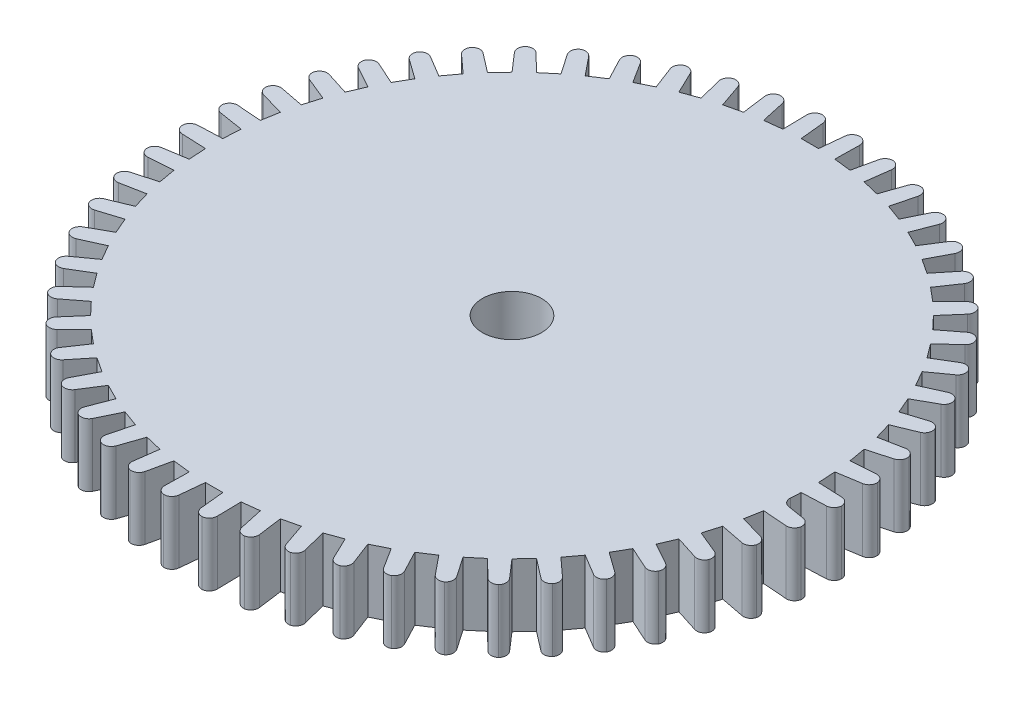
from build123d import *

# Parameters (mm, degrees)
SKETCH1_R           = 0.75
BOSS_EXTRUDE1_DEPTH = 1.6
FILLET2_R           = 0.2
FILLET3_R           = 0.2
FILLET4_R           = 0.2
FILLET5_R           = 0.2


with BuildPart() as part:
    # Sketch1 → Boss-Extrude1 (new body)
    with BuildSketch(Plane(origin=(0, 0, 0), x_dir=(1, 0, 0), z_dir=(0, 1, 0))):
        with BuildLine():
            Line((-0.22, 7.544609038), (0.22, 7.544609038))
            Line((0.22, 7.544609038), (0.3, 8.344609038))
            ThreePointArc((0.3, 8.344609038), (0.485509321, 8.335873122), (0.670778473, 8.323013651))
            Line((0.670778473, 8.323013651), (0.65736321, 7.519135532))
            Line((0.65736321, 7.519135532), (1.094388088, 7.46805465))
            Line((1.094388088, 7.46805465), (1.266721488, 8.253357903))
            ThreePointArc((1.266721488, 8.253357903), (1.449962284, 8.223144738), (1.632485818, 8.188863783))
            Line((1.632485818, 8.188863783), (1.525836711, 7.391978617))
            Line((1.525836711, 7.391978617), (1.953976454, 7.290507634))
            Line((1.953976454, 7.290507634), (2.216312741, 8.05049426))
            ThreePointArc((2.216312741, 8.05049426), (2.394806993, 7.999212428), (2.572116593, 7.94397358))
            Line((2.572116593, 7.94397358), (2.373675888, 7.164857871))
            Line((2.373675888, 7.164857871), (2.787140641, 7.014369008))
            Line((2.787140641, 7.014369008), (3.135932165, 7.738761494))
            ThreePointArc((3.135932165, 7.738761494), (3.307266046, 7.667104492), (3.476963903, 7.591654761))
            Line((3.476963903, 7.591654761), (3.18941517, 6.840844715))
            Line((3.18941517, 6.840844715), (3.582613532, 6.643373075))
            Line((3.582613532, 6.643373075), (4.013143488, 7.322375253))
            ThreePointArc((4.013143488, 7.322375253), (4.175, 7.231312122), (4.334791242, 7.136671836))
            Line((4.334791242, 7.136671836), (3.962023084, 6.424320868))
            Line((3.962023084, 6.424320868), (4.329637721, 6.182536918))
            Line((4.329637721, 6.182536918), (4.836083928, 6.806966449))
            ThreePointArc((4.836083928, 6.806966449), (4.986274241, 6.69772866), (5.133997964, 6.585177667))
            Line((5.133997964, 6.585177667), (4.681051432, 5.920919103))
            Line((4.681051432, 5.920919103), (5.018110987, 5.638092555))
            Line((5.018110987, 5.638092555), (5.59362463, 6.199505101))
            ThreePointArc((5.59362463, 6.199505101), (5.730117676, 6.073569907), (5.863776172, 5.944630266))
            Line((5.863776172, 5.944630266), (5.33677659, 5.337447065))
            Line((5.33677659, 5.337447065), (5.638722911, 5.017402662))
            Line((5.638722911, 5.017402662), (6.275521155, 5.508206081))
            ThreePointArc((6.275521155, 5.508206081), (6.3964711, 5.367276541), (6.514256866, 5.223691939))
            Line((6.514256866, 5.223691939), (5.920331, 4.681795211))
            Line((5.920331, 4.681795211), (6.18308078, 4.328861006))
            Line((6.18308078, 4.328861006), (6.872552022, 4.742418024))
            ThreePointArc((6.872552022, 4.742418024), (6.976323225, 4.588399967), (7.076643412, 4.43211214))
            Line((7.076643412, 4.43211214), (6.423823089, 3.962830108))
            Line((6.423823089, 3.962830108), (6.643823089, 3.58177893))
            Line((6.643823089, 3.58177893), (7.376643412, 3.912496898))
            ThreePointArc((7.376643412, 3.912496898), (7.461832547, 3.747473155), (7.543330495, 3.580595628))
            Line((7.543330495, 3.580595628), (6.84044399, 3.190274526))
            Line((6.84044399, 3.190274526), (7.014719087, 2.786259439))
            Line((7.014719087, 2.786259439), (7.780978354, 3.029665963))
            ThreePointArc((7.780978354, 3.029665963), (7.846433384, 2.855868197), (7.908006973, 2.680657702))
            Line((7.908006973, 2.680657702), (7.164559622, 2.374575954))
            Line((7.164559622, 2.374575954), (7.290753044, 1.953060569))
            Line((7.290753044, 1.953060569), (8.080088913, 2.105863994))
            ThreePointArc((8.080088913, 2.105863994), (8.124924669, 1.925642521), (8.165741223, 1.744468479))
            Line((8.165741223, 1.744468479), (7.391786875, 1.526765316))
            Line((7.391786875, 1.526765316), (7.468192073, 1.093449905))
            Line((7.468192073, 1.093449905), (8.26993013, 1.153583827))
            ThreePointArc((8.26993013, 1.153583827), (8.293540287, 0.969375833), (8.313047832, 0.784688312))
            Line((8.313047832, 0.784688312), (7.519052891, 0.658307797))
            Line((7.519052891, 0.658307797), (7.544636616, 0.219052207))
            Line((7.544636616, 0.219052207), (8.347934729, 0.185703417))
            ThreePointArc((8.347934729, 0.185703417), (8.35, 0), (8.347934729, -0.185703417))
            Line((8.347934729, -0.185703417), (7.544636616, -0.219052207))
            Line((7.544636616, -0.219052207), (7.519052891, -0.658307797))
            Line((7.519052891, -0.658307797), (8.313047832, -0.784688312))
            ThreePointArc((8.313047832, -0.784688312), (8.293540287, -0.969375833), (8.26993013, -1.153583827))
            Line((8.26993013, -1.153583827), (7.468192073, -1.093449905))
            Line((7.468192073, -1.093449905), (7.391786875, -1.526765316))
            Line((7.391786875, -1.526765316), (8.165741223, -1.744468479))
            ThreePointArc((8.165741223, -1.744468479), (8.124924669, -1.925642521), (8.080088913, -2.105863994))
            Line((8.080088913, -2.105863994), (7.290753044, -1.953060569))
            Line((7.290753044, -1.953060569), (7.164559622, -2.374575954))
            Line((7.164559622, -2.374575954), (7.908006973, -2.680657702))
            ThreePointArc((7.908006973, -2.680657702), (7.846433384, -2.855868197), (7.780978354, -3.029665963))
            Line((7.780978354, -3.029665963), (7.014719087, -2.786259439))
            Line((7.014719087, -2.786259439), (6.84044399, -3.190274526))
            Line((6.84044399, -3.190274526), (7.543330495, -3.580595628))
            ThreePointArc((7.543330495, -3.580595628), (7.461832547, -3.747473155), (7.376643412, -3.912496898))
            Line((7.376643412, -3.912496898), (6.643823089, -3.58177893))
            Line((6.643823089, -3.58177893), (6.423823089, -3.962830108))
            Line((6.423823089, -3.962830108), (7.076643412, -4.43211214))
            ThreePointArc((7.076643412, -4.43211214), (6.976323225, -4.588399967), (6.872552022, -4.742418024))
            Line((6.872552022, -4.742418024), (6.18308078, -4.328861006))
            Line((6.18308078, -4.328861006), (5.920331, -4.681795211))
            Line((5.920331, -4.681795211), (6.514256866, -5.223691939))
            ThreePointArc((6.514256866, -5.223691939), (6.3964711, -5.367276541), (6.275521155, -5.508206081))
            Line((6.275521155, -5.508206081), (5.638722911, -5.017402662))
            Line((5.638722911, -5.017402662), (5.33677659, -5.337447065))
            Line((5.33677659, -5.337447065), (5.863776172, -5.944630266))
            ThreePointArc((5.863776172, -5.944630266), (5.730117676, -6.073569907), (5.59362463, -6.199505101))
            Line((5.59362463, -6.199505101), (5.018110987, -5.638092555))
            Line((5.018110987, -5.638092555), (4.681051432, -5.920919103))
            Line((4.681051432, -5.920919103), (5.133997964, -6.585177667))
            ThreePointArc((5.133997964, -6.585177667), (4.986274241, -6.69772866), (4.836083928, -6.806966449))
            Line((4.836083928, -6.806966449), (4.329637721, -6.182536918))
            Line((4.329637721, -6.182536918), (3.962023084, -6.424320868))
            Line((3.962023084, -6.424320868), (4.334791242, -7.136671836))
            ThreePointArc((4.334791242, -7.136671836), (4.175, -7.231312122), (4.013143488, -7.322375253))
            Line((4.013143488, -7.322375253), (3.582613532, -6.643373075))
            Line((3.582613532, -6.643373075), (3.18941517, -6.840844715))
            Line((3.18941517, -6.840844715), (3.476963903, -7.591654761))
            ThreePointArc((3.476963903, -7.591654761), (3.307266046, -7.667104492), (3.135932165, -7.738761494))
            Line((3.135932165, -7.738761494), (2.787140641, -7.014369008))
            Line((2.787140641, -7.014369008), (2.373675888, -7.164857871))
            Line((2.373675888, -7.164857871), (2.572116593, -7.94397358))
            ThreePointArc((2.572116593, -7.94397358), (2.394806993, -7.999212428), (2.216312741, -8.05049426))
            Line((2.216312741, -8.05049426), (1.953976454, -7.290507634))
            Line((1.953976454, -7.290507634), (1.525836711, -7.391978617))
            Line((1.525836711, -7.391978617), (1.632485818, -8.188863783))
            ThreePointArc((1.632485818, -8.188863783), (1.449962284, -8.223144738), (1.266721488, -8.253357903))
            Line((1.266721488, -8.253357903), (1.094388088, -7.46805465))
            Line((1.094388088, -7.46805465), (0.65736321, -7.519135532))
            Line((0.65736321, -7.519135532), (0.670778473, -8.323013651))
            ThreePointArc((0.670778473, -8.323013651), (0.485509321, -8.335873122), (0.3, -8.344609038))
            Line((0.3, -8.344609038), (0.22, -7.544609038))
            Line((0.22, -7.544609038), (-0.22, -7.544609038))
            Line((-0.22, -7.544609038), (-0.3, -8.344609038))
            ThreePointArc((-0.3, -8.344609038), (-0.485509321, -8.335873122), (-0.670778473, -8.323013651))
            Line((-0.670778473, -8.323013651), (-0.65736321, -7.519135532))
            Line((-0.65736321, -7.519135532), (-1.094388088, -7.46805465))
            Line((-1.094388088, -7.46805465), (-1.266721488, -8.253357903))
            ThreePointArc((-1.266721488, -8.253357903), (-1.449962284, -8.223144738), (-1.632485818, -8.188863783))
            Line((-1.632485818, -8.188863783), (-1.525836711, -7.391978617))
            Line((-1.525836711, -7.391978617), (-1.953976454, -7.290507634))
            Line((-1.953976454, -7.290507634), (-2.216312741, -8.05049426))
            ThreePointArc((-2.216312741, -8.05049426), (-2.394806993, -7.999212428), (-2.572116593, -7.94397358))
            Line((-2.572116593, -7.94397358), (-2.373675888, -7.164857871))
            Line((-2.373675888, -7.164857871), (-2.787140641, -7.014369008))
            Line((-2.787140641, -7.014369008), (-3.135932165, -7.738761494))
            ThreePointArc((-3.135932165, -7.738761494), (-3.307266046, -7.667104492), (-3.476963903, -7.591654761))
            Line((-3.476963903, -7.591654761), (-3.18941517, -6.840844715))
            Line((-3.18941517, -6.840844715), (-3.582613532, -6.643373075))
            Line((-3.582613532, -6.643373075), (-4.013143488, -7.322375253))
            ThreePointArc((-4.013143488, -7.322375253), (-4.175, -7.231312122), (-4.334791242, -7.136671836))
            Line((-4.334791242, -7.136671836), (-3.962023084, -6.424320868))
            Line((-3.962023084, -6.424320868), (-4.329637721, -6.182536918))
            Line((-4.329637721, -6.182536918), (-4.836083928, -6.806966449))
            ThreePointArc((-4.836083928, -6.806966449), (-4.986274241, -6.69772866), (-5.133997964, -6.585177667))
            Line((-5.133997964, -6.585177667), (-4.681051432, -5.920919103))
            Line((-4.681051432, -5.920919103), (-5.018110987, -5.638092555))
            Line((-5.018110987, -5.638092555), (-5.59362463, -6.199505101))
            ThreePointArc((-5.59362463, -6.199505101), (-5.730117676, -6.073569907), (-5.863776172, -5.944630266))
            Line((-5.863776172, -5.944630266), (-5.33677659, -5.337447065))
            Line((-5.33677659, -5.337447065), (-5.638722911, -5.017402662))
            Line((-5.638722911, -5.017402662), (-6.275521155, -5.508206081))
            ThreePointArc((-6.275521155, -5.508206081), (-6.3964711, -5.367276541), (-6.514256866, -5.223691939))
            Line((-6.514256866, -5.223691939), (-5.920331, -4.681795211))
            Line((-5.920331, -4.681795211), (-6.18308078, -4.328861006))
            Line((-6.18308078, -4.328861006), (-6.872552022, -4.742418024))
            ThreePointArc((-6.872552022, -4.742418024), (-6.976323225, -4.588399967), (-7.076643412, -4.43211214))
            Line((-7.076643412, -4.43211214), (-6.423823089, -3.962830108))
            Line((-6.423823089, -3.962830108), (-6.643823089, -3.58177893))
            Line((-6.643823089, -3.58177893), (-7.376643412, -3.912496898))
            ThreePointArc((-7.376643412, -3.912496898), (-7.461832547, -3.747473155), (-7.543330495, -3.580595628))
            Line((-7.543330495, -3.580595628), (-6.84044399, -3.190274526))
            Line((-6.84044399, -3.190274526), (-7.014719087, -2.786259439))
            Line((-7.014719087, -2.786259439), (-7.780978354, -3.029665963))
            ThreePointArc((-7.780978354, -3.029665963), (-7.846433384, -2.855868197), (-7.908006973, -2.680657702))
            Line((-7.908006973, -2.680657702), (-7.164559622, -2.374575954))
            Line((-7.164559622, -2.374575954), (-7.290753044, -1.953060569))
            Line((-7.290753044, -1.953060569), (-8.080088913, -2.105863994))
            ThreePointArc((-8.080088913, -2.105863994), (-8.124924669, -1.925642521), (-8.165741223, -1.744468479))
            Line((-8.165741223, -1.744468479), (-7.391786875, -1.526765316))
            Line((-7.391786875, -1.526765316), (-7.468192073, -1.093449905))
            Line((-7.468192073, -1.093449905), (-8.26993013, -1.153583827))
            ThreePointArc((-8.26993013, -1.153583827), (-8.293540287, -0.969375833), (-8.313047832, -0.784688312))
            Line((-8.313047832, -0.784688312), (-7.519052891, -0.658307797))
            Line((-7.519052891, -0.658307797), (-7.544636616, -0.219052207))
            Line((-7.544636616, -0.219052207), (-8.347934729, -0.185703417))
            ThreePointArc((-8.347934729, -0.185703417), (-8.35, 0), (-8.347934729, 0.185703417))
            Line((-8.347934729, 0.185703417), (-7.544636616, 0.219052207))
            Line((-7.544636616, 0.219052207), (-7.519052891, 0.658307797))
            Line((-7.519052891, 0.658307797), (-8.313047832, 0.784688312))
            ThreePointArc((-8.313047832, 0.784688312), (-8.293540287, 0.969375833), (-8.26993013, 1.153583827))
            Line((-8.26993013, 1.153583827), (-7.468192073, 1.093449905))
            Line((-7.468192073, 1.093449905), (-7.391786875, 1.526765316))
            Line((-7.391786875, 1.526765316), (-8.165741223, 1.744468479))
            ThreePointArc((-8.165741223, 1.744468479), (-8.124924669, 1.925642521), (-8.080088913, 2.105863994))
            Line((-8.080088913, 2.105863994), (-7.290753044, 1.953060569))
            Line((-7.290753044, 1.953060569), (-7.164559622, 2.374575954))
            Line((-7.164559622, 2.374575954), (-7.908006973, 2.680657702))
            ThreePointArc((-7.908006973, 2.680657702), (-7.846433384, 2.855868197), (-7.780978354, 3.029665963))
            Line((-7.780978354, 3.029665963), (-7.014719087, 2.786259439))
            Line((-7.014719087, 2.786259439), (-6.84044399, 3.190274526))
            Line((-6.84044399, 3.190274526), (-7.543330495, 3.580595628))
            ThreePointArc((-7.543330495, 3.580595628), (-7.461832547, 3.747473155), (-7.376643412, 3.912496898))
            Line((-7.376643412, 3.912496898), (-6.643823089, 3.58177893))
            Line((-6.643823089, 3.58177893), (-6.423823089, 3.962830108))
            Line((-6.423823089, 3.962830108), (-7.076643412, 4.43211214))
            ThreePointArc((-7.076643412, 4.43211214), (-6.976323225, 4.588399967), (-6.872552022, 4.742418024))
            Line((-6.872552022, 4.742418024), (-6.18308078, 4.328861006))
            Line((-6.18308078, 4.328861006), (-5.920331, 4.681795211))
            Line((-5.920331, 4.681795211), (-6.514256866, 5.223691939))
            ThreePointArc((-6.514256866, 5.223691939), (-6.3964711, 5.367276541), (-6.275521155, 5.508206081))
            Line((-6.275521155, 5.508206081), (-5.638722911, 5.017402662))
            Line((-5.638722911, 5.017402662), (-5.33677659, 5.337447065))
            Line((-5.33677659, 5.337447065), (-5.863776172, 5.944630266))
            ThreePointArc((-5.863776172, 5.944630266), (-5.730117676, 6.073569907), (-5.59362463, 6.199505101))
            Line((-5.59362463, 6.199505101), (-5.018110987, 5.638092555))
            Line((-5.018110987, 5.638092555), (-4.681051432, 5.920919103))
            Line((-4.681051432, 5.920919103), (-5.133997964, 6.585177667))
            ThreePointArc((-5.133997964, 6.585177667), (-4.986274241, 6.69772866), (-4.836083928, 6.806966449))
            Line((-4.836083928, 6.806966449), (-4.329637721, 6.182536918))
            Line((-4.329637721, 6.182536918), (-3.962023084, 6.424320868))
            Line((-3.962023084, 6.424320868), (-4.334791242, 7.136671836))
            ThreePointArc((-4.334791242, 7.136671836), (-4.175, 7.231312122), (-4.013143488, 7.322375253))
            Line((-4.013143488, 7.322375253), (-3.582613532, 6.643373075))
            Line((-3.582613532, 6.643373075), (-3.18941517, 6.840844715))
            Line((-3.18941517, 6.840844715), (-3.476963903, 7.591654761))
            ThreePointArc((-3.476963903, 7.591654761), (-3.307266046, 7.667104492), (-3.135932165, 7.738761494))
            Line((-3.135932165, 7.738761494), (-2.787140641, 7.014369008))
            Line((-2.787140641, 7.014369008), (-2.373675888, 7.164857871))
            Line((-2.373675888, 7.164857871), (-2.572116593, 7.94397358))
            ThreePointArc((-2.572116593, 7.94397358), (-2.394806993, 7.999212428), (-2.216312741, 8.05049426))
            Line((-2.216312741, 8.05049426), (-1.953976454, 7.290507634))
            Line((-1.953976454, 7.290507634), (-1.525836711, 7.391978617))
            Line((-1.525836711, 7.391978617), (-1.632485818, 8.188863783))
            ThreePointArc((-1.632485818, 8.188863783), (-1.449962284, 8.223144738), (-1.266721488, 8.253357903))
            Line((-1.266721488, 8.253357903), (-1.094388088, 7.46805465))
            Line((-1.094388088, 7.46805465), (-0.65736321, 7.519135532))
            Line((-0.65736321, 7.519135532), (-0.670778473, 8.323013651))
            ThreePointArc((-0.670778473, 8.323013651), (-0.485509321, 8.335873122), (-0.3, 8.344609038))
            Line((-0.3, 8.344609038), (-0.22, 7.544609038))
        make_face()
        with Locations(Location((0, 0, 0), (0, 0, 270))):
            Circle(SKETCH1_R, mode=Mode.SUBTRACT)
    extrude(amount=BOSS_EXTRUDE1_DEPTH)

    # Fillet2
    # the kernel refuses this fillet: 0.2 mm, written as the material it takes off along each edge
    with BuildSketch(Plane(origin=(4.334791242, -0.480298583, 7.136671836), x_dir=(-0.46364772510243835, 0, -0.8860196312764937), z_dir=(0, 1, 0))) as fillet2_piece_1:
        with BuildLine():
            CenterArc((0.189804657, 0.2), FILLET2_R, 182.333310568, 87.666689432)
            ThreePointArc((-0.010029522, 0.191857461), (-0.005566569, 0.095899884), (0, 0))
            Line((0, 0), (0.189804657, 0))
        make_face()
    extrude(amount=2.560597165, mode=Mode.SUBTRACT)
    with BuildSketch(Plane(origin=(4.013143488, -0.480298583, 7.322375253), x_dir=(0.8713440550306768, 0, -0.49067253618140977), z_dir=(0, 1, 0))) as fillet2_piece_2:
        with BuildLine():
            CenterArc((0.189818601, 0.199986765), FILLET2_R, 182.992464789, 87.666689432)
            Line((-0.00990868, 0.189545841), (0, 0))
            ThreePointArc((0, 0), (0.096059717, -0.000552561), (0.192119433, 0))
        make_face()
    extrude(amount=2.560597165, mode=Mode.SUBTRACT)

    # Fillet3
    # the kernel refuses this fillet: 0.2 mm, written as the material it adds along each edge
    with BuildSketch(Plane(origin=(7.519052891, 0, 0.658307797), x_dir=(0.98756811805152, 0, 0.15719164166131472), z_dir=(0, 1, 0))) as fillet3_piece_1:
        with BuildLine():
            CenterArc((FILLET3_R * 0.904987562112, FILLET3_R), FILLET3_R, 185.710593137, 84.289406863)
            Line((-FILLET3_R * 0.0900496280979, FILLET3_R * 0.900496280979), (0, 0))
            Line((0, 0), (FILLET3_R * 0.904987562112, 0))
        make_face()
    extrude(amount=1.6)
    # the kernel refuses this fillet: 0.2 mm, written as the material it takes off along each edge
    with BuildSketch(Plane(origin=(5.863776172, -0.480298583, -5.944630266), x_dir=(-0.6554802294286503, 0, 0.7552123336043739), z_dir=(0, 1, 0)), Plane(origin=(6.514256866, -0.480298583, -5.223691939), x_dir=(-0.7387229072014744, 0, 0.6740092479898195), z_dir=(0, 1, 0)), Plane(origin=(7.076643412, -0.480298583, -4.43211214), x_dir=(-0.81197562492164, 0, 0.5836913435482081), z_dir=(0, 1, 0)), Plane(origin=(7.543330495, -0.480298583, -3.580595628), x_dir=(-0.8742477652458406, 0, 0.4854800149982011), z_dir=(0, 1, 0)), Plane(origin=(7.908006973, -0.480298583, -2.680657702), x_dir=(-0.9246972043030404, 0, 0.38070340207849634), z_dir=(0, 1, 0)), Plane(origin=(8.165741223, -0.480298583, -1.744468479), x_dir=(-0.9626416999752018, 0, 0.27077842873621544), z_dir=(0, 1, 0)), Plane(origin=(8.313047832, -0.480298583, -0.784688312), x_dir=(-0.9875681180515197, 0, 0.15719164166131647), z_dir=(0, 1, 0)), Plane(origin=(8.347934729, -0.480298583, 0.185703417), x_dir=(-0.9991393714883839, 0, 0.041479107292674414), z_dir=(0, 1, 0)), Plane(origin=(8.26993013, -0.480298583, 1.153583827), x_dir=(-0.9971989789333593, 0, -0.07479436084536017), z_dir=(0, 1, 0)), Plane(origin=(8.080088913, -0.480298583, 2.105863994), x_dir=(-0.98177318086704, 0, -0.1900563635614821), z_dir=(0, 1, 0)), Plane(origin=(7.780978354, -0.480298583, 3.029665963), x_dir=(-0.9530705847455657, 0, -0.3027481799990632), z_dir=(0, 1, 0)), Plane(origin=(7.376643412, -0.480298583, 3.912496898), x_dir=(-0.9114793439426387, 0, -0.4113458466617805), z_dir=(0, 1, 0)), Plane(origin=(6.872552022, -0.480298583, 4.742418024), x_dir=(-0.8575619086410138, 0, -0.5143807664055701), z_dir=(0, 1, 0)), Plane(origin=(6.275521155, -0.480298583, 5.508206081), x_dir=(-0.7920474196586587, 0, -0.6104595686956351), z_dir=(0, 1, 0)), Plane(origin=(5.59362463, -0.480298583, 6.199505101), x_dir=(-0.7158218480699943, 0, -0.6982829525526582), z_dir=(0, 1, 0)), Plane(origin=(4.836083928, -0.480298583, 6.806966449), x_dir=(-0.6299160139670423, 0, -0.7766632573695456), z_dir=(0, 1, 0))) as fillet3_2_piece_1:
        with BuildLine():
            CenterArc((0.189804657, -0.2), FILLET3_R, 90, 87.666689432)
            ThreePointArc((-0.010029522, -0.191857461), (-0.005566569, -0.095899884), (0, 0))
            Line((0, 0), (0.189804657, 0))
        make_face()
    extrude(amount=2.560597165, mode=Mode.SUBTRACT)
    with BuildSketch(Plane(origin=(5.59362463, -0.480298583, -6.199505101), x_dir=(0.7346999890769462, 0, 0.6783921624328624), z_dir=(0, 1, 0)), Plane(origin=(6.275521155, -0.480298583, -5.508206081), x_dir=(0.6509756875272619, 0, 0.7590985800595393), z_dir=(0, 1, 0)), Plane(origin=(6.872552022, -0.480298583, -4.742418024), x_dir=(0.558448056542093, 0, 0.8295394916122796), z_dir=(0, 1, 0)), Plane(origin=(7.376643412, -0.480298583, -3.912496898), x_dir=(0.4583683736008077, 0, 0.8887623046026145), z_dir=(0, 1, 0)), Plane(origin=(7.780978354, -0.480298583, -3.029665963), x_dir=(0.3520900447301269, 0, 0.9359661320806096), z_dir=(0, 1, 0)), Plane(origin=(8.080088913, -0.480298583, -2.105863994), x_dir=(0.2410503020092946, 0, 0.9705126232570227), z_dir=(0, 1, 0)), Plane(origin=(8.26993013, -0.480298583, -1.153583827), x_dir=(0.1267507674716833, 0, 0.991934596102656), z_dir=(0, 1, 0)), Plane(origin=(8.347934729, -0.480298583, -0.185703417), x_dir=(0.010737146242911869, 0, 0.9999423551838168), z_dir=(0, 1, 0)), Plane(origin=(8.313047832, -0.480298583, 0.784688312), x_dir=(-0.10542167646940234, 0, 0.994427609296112), z_dir=(0, 1, 0)), Plane(origin=(8.165741223, -0.480298583, 1.744468479), x_dir=(-0.22015485185665176, 0, 0.9754649359172146), z_dir=(0, 1, 0)), Plane(origin=(7.908006973, -0.480298583, 2.680657702), x_dir=(-0.3319108105446167, 0, 0.9433107726744222), z_dir=(0, 1, 0)), Plane(origin=(7.543330495, -0.480298583, 3.580595628), x_dir=(-0.43917824490763746, 0, 0.8983999494656303), z_dir=(0, 1, 0)), Plane(origin=(7.076643412, -0.480298583, 4.43211214), x_dir=(-0.5405065469114751, 0, 0.8413398081309557), z_dir=(0, 1, 0)), Plane(origin=(6.514256866, -0.480298583, 5.223691939), x_dir=(-0.6345254250985933, 0, 0.7729019891962042), z_dir=(0, 1, 0)), Plane(origin=(5.863776172, -0.480298583, 5.944630266), x_dir=(-0.7199634354294149, 0, 0.6940119967584673), z_dir=(0, 1, 0)), Plane(origin=(5.133997964, -0.480298583, 6.585177667), x_dir=(-0.7956651753817232, 0, 0.6057366826309694), z_dir=(0, 1, 0))) as fillet3_2_piece_2:
        with BuildLine():
            CenterArc((0.189818601, -0.199986765), FILLET3_R, 89.340845779, 87.666689432)
            Line((-0.00990868, -0.189545841), (0, 0))
            ThreePointArc((0, 0), (0.096059717, 0.000552561), (0.192119433, 0))
        make_face()
    extrude(amount=2.560597165, mode=Mode.SUBTRACT)

    # Fillet4
    # the kernel refuses this fillet: 0.2 mm, written as the material it takes off along each edge
    with BuildSketch(Plane(origin=(-4.334791242, -0.480298583, 7.136671836), x_dir=(0.4636477251024346, 0, -0.8860196312764955), z_dir=(0, 1, 0)), Plane(origin=(-3.476963903, -0.480298583, 7.591654761), x_dir=(0.3576521040844768, 0, -0.9338548990308647), z_dir=(0, 1, 0)), Plane(origin=(-5.133997964, -0.480298583, 6.585177667), x_dir=(0.5633733060185829, 0, -0.8262024679615113), z_dir=(0, 1, 0)), Plane(origin=(-5.863776172, -0.480298583, 5.944630266), x_dir=(0.6554802294286552, 0, -0.7552123336043696), z_dir=(0, 1, 0)), Plane(origin=(-6.514256866, -0.480298583, 5.223691939), x_dir=(0.7387229072014774, 0, -0.6740092479898161), z_dir=(0, 1, 0)), Plane(origin=(-7.076643412, -0.480298583, 4.43211214), x_dir=(0.8119756249216388, 0, -0.5836913435482098), z_dir=(0, 1, 0)), Plane(origin=(-7.543330495, -0.480298583, 3.580595628), x_dir=(0.8742477652458391, 0, -0.4854800149982039), z_dir=(0, 1, 0)), Plane(origin=(-7.908006973, -0.480298583, 2.680657702), x_dir=(0.9246972043030436, 0, -0.3807034020784887), z_dir=(0, 1, 0)), Plane(origin=(-8.165741223, -0.480298583, 1.744468479), x_dir=(0.9626416999752027, 0, -0.27077842873621233), z_dir=(0, 1, 0)), Plane(origin=(-8.313047832, -0.480298583, 0.784688312), x_dir=(0.98756811805152, 0, -0.15719164166131375), z_dir=(0, 1, 0)), Plane(origin=(-8.347934729, -0.480298583, -0.185703417), x_dir=(0.9991393714883839, 0, -0.04147910729267451), z_dir=(0, 1, 0)), Plane(origin=(-8.26993013, -0.480298583, -1.153583827), x_dir=(0.9971989789333593, 0, 0.07479436084535854), z_dir=(0, 1, 0)), Plane(origin=(-8.080088913, -0.480298583, -2.105863994), x_dir=(0.98177318086704, 0, 0.1900563635614817), z_dir=(0, 1, 0)), Plane(origin=(-7.780978354, -0.480298583, -3.029665963), x_dir=(0.9530705847455657, 0, 0.3027481799990632), z_dir=(0, 1, 0)), Plane(origin=(-7.376643412, -0.480298583, -3.912496898), x_dir=(0.9114793439426382, 0, 0.41134584666178187), z_dir=(0, 1, 0)), Plane(origin=(-6.872552022, -0.480298583, -4.742418024), x_dir=(0.8575619086410154, 0, 0.5143807664055673), z_dir=(0, 1, 0)), Plane(origin=(-5.59362463, -0.480298583, -6.199505101), x_dir=(0.715821848069999, 0, 0.6982829525526533), z_dir=(0, 1, 0)), Plane(origin=(-6.275521155, -0.480298583, -5.508206081), x_dir=(0.7920474196586564, 0, 0.6104595686956378), z_dir=(0, 1, 0)), Plane(origin=(-4.836083928, -0.480298583, -6.806966449), x_dir=(0.6299160139670348, 0, 0.7766632573695517), z_dir=(0, 1, 0)), Plane(origin=(-4.013143488, -0.480298583, -7.322375253), x_dir=(0.5354916463859504, 0, 0.8445405239838195), z_dir=(0, 1, 0)), Plane(origin=(-3.135932165, -0.480298583, -7.738761494), x_dir=(0.4338256729147788, 0, 0.9009968288068717), z_dir=(0, 1, 0)), Plane(origin=(-1.266721488, -0.480298583, -8.253357903), x_dir=(0.21434767754407721, 0, 0.9767574279888843), z_dir=(0, 1, 0)), Plane(origin=(-2.216312741, -0.480298583, -8.05049426), x_dir=(0.32629295143839016, 0, 0.9452686971658505), z_dir=(0, 1, 0)), Plane(origin=(-0.3, -0.480298583, -8.344609038), x_dir=(0.09950371902100257, 0, 0.9950371902099888), z_dir=(0, 1, 0)), Plane(origin=(0.670778473, -0.480298583, -8.323013651), x_dir=(-0.016685856604826292, 0, 0.9998607814037728), z_dir=(0, 1, 0)), Plane(origin=(1.632485818, -0.480298583, -8.188863783), x_dir=(-0.13264978464438845, 0, 0.9911629707741293), z_dir=(0, 1, 0)), Plane(origin=(2.572116593, -0.480298583, -7.94397358), x_dir=(-0.24681985190520428, 0, 0.9690613812888701), z_dir=(0, 1, 0)), Plane(origin=(3.476963903, -0.480298583, -7.591654761), x_dir=(-0.35765210408447834, 0, 0.9338548990308642), z_dir=(0, 1, 0)), Plane(origin=(4.334791242, -0.480298583, -7.136671836), x_dir=(-0.4636477251024367, 0, 0.8860196312764944), z_dir=(0, 1, 0)), Plane(origin=(5.133997964, -0.480298583, -6.585177667), x_dir=(-0.5633733060185832, 0, 0.8262024679615113), z_dir=(0, 1, 0))) as fillet4_piece_1:
        with BuildLine():
            CenterArc((0.189804657, -0.2), FILLET4_R, 90, 87.666689432)
            ThreePointArc((-0.010029522, -0.191857461), (-0.005566569, -0.095899884), (0, 0))
            Line((0, 0), (0.189804657, 0))
        make_face()
    extrude(amount=2.560597165, mode=Mode.SUBTRACT)
    with BuildSketch(Plane(origin=(-4.013143488, -0.480298583, 7.322375253), x_dir=(-0.8713440550306827, 0, -0.4906725361813992), z_dir=(0, 1, 0)), Plane(origin=(-3.135932165, -0.480298583, 7.738761494), x_dir=(-0.9224159428533883, 0, -0.3861979134717), z_dir=(0, 1, 0)), Plane(origin=(-4.836083928, -0.480298583, 6.806966449), x_dir=(-0.8084887336403573, 0, -0.5885116545801038), z_dir=(0, 1, 0)), Plane(origin=(-5.59362463, -0.480298583, 6.199505101), x_dir=(-0.734699989076951, 0, -0.6783921624328572), z_dir=(0, 1, 0)), Plane(origin=(-6.275521155, -0.480298583, 5.508206081), x_dir=(-0.6509756875272619, 0, -0.7590985800595393), z_dir=(0, 1, 0)), Plane(origin=(-6.872552022, -0.480298583, 4.742418024), x_dir=(-0.5584480565420684, 0, -0.8295394916122961), z_dir=(0, 1, 0)), Plane(origin=(-7.376643412, -0.480298583, 3.912496898), x_dir=(-0.45836837360079474, 0, -0.8887623046026212), z_dir=(0, 1, 0)), Plane(origin=(-7.780978354, -0.480298583, 3.029665963), x_dir=(-0.3520900447301365, 0, -0.935966132080606), z_dir=(0, 1, 0)), Plane(origin=(-8.080088913, -0.480298583, 2.105863994), x_dir=(-0.24105030200928482, 0, -0.9705126232570253), z_dir=(0, 1, 0)), Plane(origin=(-8.26993013, -0.480298583, 1.153583827), x_dir=(-0.12675076747165503, 0, -0.9919345961026595), z_dir=(0, 1, 0)), Plane(origin=(-8.347934729, -0.480298583, 0.185703417), x_dir=(-0.010737146242902671, 0, -0.9999423551838169), z_dir=(0, 1, 0)), Plane(origin=(-8.313047832, -0.480298583, -0.784688312), x_dir=(0.1054216764694024, 0, -0.994427609296112), z_dir=(0, 1, 0)), Plane(origin=(-8.165741223, -0.480298583, -1.744468479), x_dir=(0.22015485185663566, 0, -0.9754649359172183), z_dir=(0, 1, 0)), Plane(origin=(-7.908006973, -0.480298583, -2.680657702), x_dir=(0.3319108105446235, 0, -0.9433107726744199), z_dir=(0, 1, 0)), Plane(origin=(-7.543330495, -0.480298583, -3.580595628), x_dir=(0.43917824490763846, 0, -0.8983999494656298), z_dir=(0, 1, 0)), Plane(origin=(-7.076643412, -0.480298583, -4.43211214), x_dir=(0.5405065469114728, 0, -0.8413398081309572), z_dir=(0, 1, 0)), Plane(origin=(-5.863776172, -0.480298583, -5.944630266), x_dir=(0.7199634354294149, 0, -0.6940119967584673), z_dir=(0, 1, 0)), Plane(origin=(-6.514256866, -0.480298583, -5.223691939), x_dir=(0.6345254250986062, 0, -0.7729019891961938), z_dir=(0, 1, 0)), Plane(origin=(-5.133997964, -0.480298583, -6.585177667), x_dir=(0.795665175381731, 0, -0.6057366826309591), z_dir=(0, 1, 0)), Plane(origin=(-4.334791242, -0.480298583, -7.136671836), x_dir=(0.8606069087877749, 0, -0.509269819002413), z_dir=(0, 1, 0)), Plane(origin=(-3.476963903, -0.480298583, -7.591654761), x_dir=(0.9139104101097595, 0, -0.4059159547160115), z_dir=(0, 1, 0)), Plane(origin=(-1.632485818, -0.480298583, -8.188863783), x_dir=(0.9828864980717174, 0, -0.1842121926157874), z_dir=(0, 1, 0)), Plane(origin=(-2.572116593, -0.480298583, -7.94397358), x_dir=(0.9548548409338602, 0, -0.2970727734834894), z_dir=(0, 1, 0)), Plane(origin=(-0.670778473, -0.480298583, -8.323013651), x_dir=(0.9976263014497105, 0, -0.06886045785333675), z_dir=(0, 1, 0)), Plane(origin=(0.3, -0.480298583, -8.344609038), x_dir=(0.9988749205122716, 0, 0.04742249647164526), z_dir=(0, 1, 0)), Plane(origin=(1.266721488, -0.480298583, -8.253357903), x_dir=(0.9866154698287336, 0, 0.16306414288440954), z_dir=(0, 1, 0)), Plane(origin=(2.216312741, -0.480298583, -8.05049426), x_dir=(0.9610137374386971, 0, 0.2765006264985795), z_dir=(0, 1, 0)), Plane(origin=(3.135932165, -0.480298583, -7.738761494), x_dir=(0.9224159428533947, 0, 0.3861979134716849), z_dir=(0, 1, 0)), Plane(origin=(4.013143488, -0.480298583, -7.322375253), x_dir=(0.871344055030683, 0, 0.4906725361813988), z_dir=(0, 1, 0)), Plane(origin=(4.836083928, -0.480298583, -6.806966449), x_dir=(0.808488733640367, 0, 0.5885116545800902), z_dir=(0, 1, 0))) as fillet4_piece_2:
        with BuildLine():
            CenterArc((0.189818601, -0.199986765), FILLET4_R, 89.340845779, 87.666689432)
            Line((-0.00990868, -0.189545841), (0, 0))
            ThreePointArc((0, 0), (0.096059717, 0.000552561), (0.192119433, 0))
        make_face()
    extrude(amount=2.560597165, mode=Mode.SUBTRACT)

    # Fillet5
    # the kernel refuses this fillet: 0.2 mm, written as the material it takes off along each edge
    with BuildSketch(Plane(origin=(-2.216312741, -0.480298583, 8.05049426), x_dir=(-0.9610137374386994, 0, -0.27650062649857154), z_dir=(0, 1, 0)), Plane(origin=(-1.266721488, -0.480298583, 8.253357903), x_dir=(-0.9866154698287319, 0, -0.16306414288442042), z_dir=(0, 1, 0)), Plane(origin=(-0.3, -0.480298583, 8.344609038), x_dir=(-0.9988749205122711, 0, -0.047422496471654384), z_dir=(0, 1, 0)), Plane(origin=(0.670778473, -0.480298583, 8.323013651), x_dir=(-0.9976263014497113, 0, 0.06886045785332744), z_dir=(0, 1, 0)), Plane(origin=(1.632485818, -0.480298583, 8.188863783), x_dir=(-0.9828864980718828, 0, 0.18421219261490568), z_dir=(0, 1, 0)), Plane(origin=(2.572116593, -0.480298583, 7.94397358), x_dir=(-0.9548548409335945, 0, 0.2970727734843429), z_dir=(0, 1, 0)), Plane(origin=(3.476963903, -0.480298583, 7.591654761), x_dir=(-0.9139104101097522, 0, 0.4059159547160283), z_dir=(0, 1, 0))) as fillet5_piece_1:
        with BuildLine():
            CenterArc((0.189818601, -0.199986765), FILLET5_R, 89.340845779, 87.666689432)
            Line((-0.00990868, -0.189545841), (0, 0))
            ThreePointArc((0, 0), (0.096059717, 0.000552561), (0.192119433, 0))
        make_face()
    extrude(amount=2.560597165, mode=Mode.SUBTRACT)
    with BuildSketch(Plane(origin=(-2.572116593, -0.480298583, 7.94397358), x_dir=(0.24681985190520428, 0, -0.9690613812888701), z_dir=(0, 1, 0)), Plane(origin=(-1.632485818, -0.480298583, 8.188863783), x_dir=(0.13264978464438956, 0, -0.991162970774129), z_dir=(0, 1, 0)), Plane(origin=(-0.670778473, -0.480298583, 8.323013651), x_dir=(0.016685856604826136, 0, -0.9998607814037728), z_dir=(0, 1, 0)), Plane(origin=(0.3, -0.480298583, 8.344609038), x_dir=(-0.09950371902099932, 0, -0.9950371902099892), z_dir=(0, 1, 0)), Plane(origin=(1.266721488, -0.480298583, 8.253357903), x_dir=(-0.21434767754409506, 0, -0.9767574279888803), z_dir=(0, 1, 0)), Plane(origin=(2.216312741, -0.480298583, 8.05049426), x_dir=(-0.32629295143838616, 0, -0.9452686971658518), z_dir=(0, 1, 0)), Plane(origin=(3.135932165, -0.480298583, 7.738761494), x_dir=(-0.43382567291477514, 0, -0.9009968288068735), z_dir=(0, 1, 0))) as fillet5_piece_2:
        with BuildLine():
            CenterArc((0.189804657, -0.2), FILLET5_R, 90, 87.666689432)
            ThreePointArc((-0.010029522, -0.191857461), (-0.005566569, -0.095899884), (0, 0))
            Line((0, 0), (0.189804657, 0))
        make_face()
    extrude(amount=2.560597165, mode=Mode.SUBTRACT)


solid = part.part
